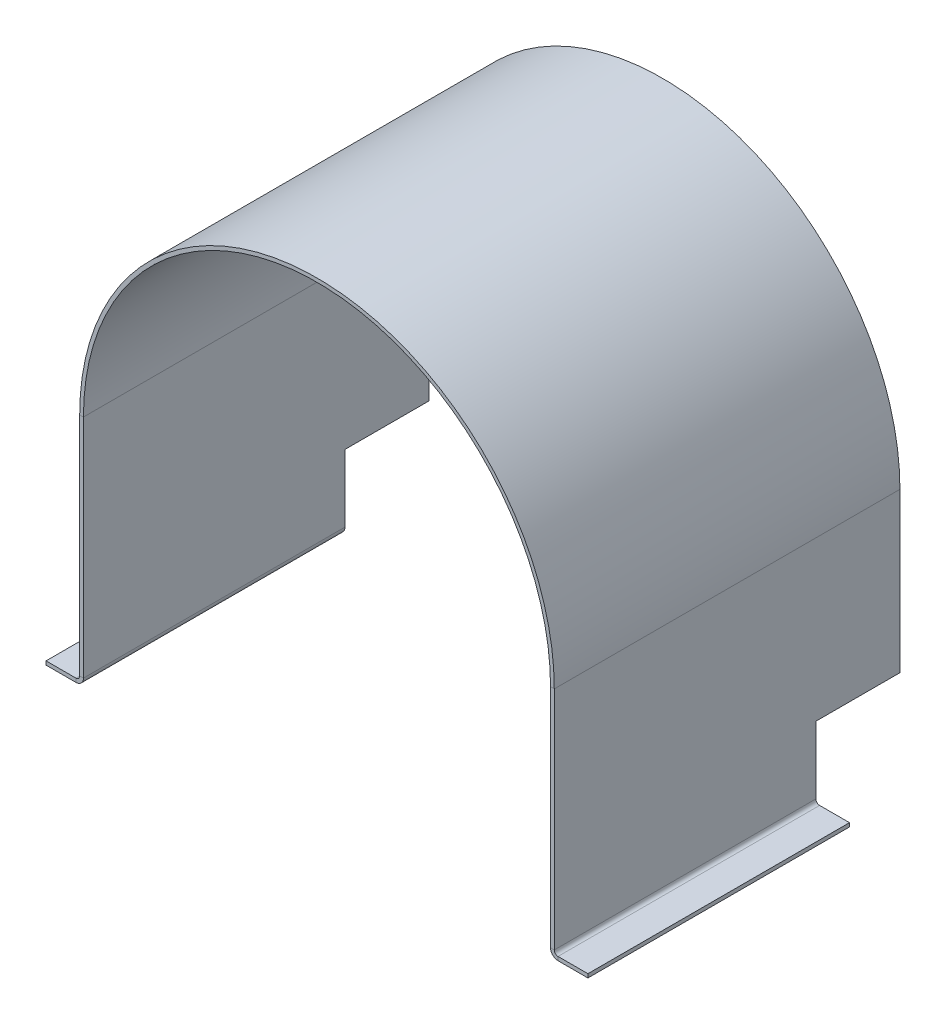
from build123d import *

# Parameters (mm, degrees)
BASE_FLANGE1_DEPTH  = 185
EXTRUDE1_DEPTH      = 353.615938381
EXTRUDE1_DEPTH_BACK = 353.615938381
SKETCH10_W          = 45
SKETCH10_H          = 40


# Sheet-metal steps are written as plain solids
with BuildPart() as part:
    # Sketch1 → Base-Flange1 (new body)
    with BuildSketch(Plane.XY):
        with BuildLine():
            Line((145, -125), (129, -125))
            ThreePointArc((129, -125), (126.171572875, -123.828427125), (125, -121))
            Line((125, -121), (125, 0))
            ThreePointArc((125, 0), (0, 125), (-125, 0))
            Line((-125, 0), (-125, -121))
            ThreePointArc((-125, -121), (-126.171572875, -123.828427125), (-129, -125))
            Line((-129, -125), (-145, -125))
            Line((-145, -125), (-145, -123))
            Line((-145, -123), (-129, -123))
            ThreePointArc((-129, -123), (-127.585786438, -122.414213562), (-127, -121))
            Line((-127, -121), (-127, 0))
            ThreePointArc((-127, 0), (0, 127), (127, 0))
            Line((127, 0), (127, -121))
            ThreePointArc((127, -121), (127.585786438, -122.414213562), (129, -123))
            Line((129, -123), (145, -123))
            Line((145, -123), (145, -125))
        make_face()
    extrude(amount=BASE_FLANGE1_DEPTH)

    # Sketch10 → Extrude1 (cut, two sides: drawn at the far end of the back side and taken through both)
    with BuildSketch(Plane(origin=(127, 0, 0), x_dir=(0, 0, -1), z_dir=(1, 0, 0)).offset(-EXTRUDE1_DEPTH_BACK)):
        with Locations((-22.5, -105)):
            Rectangle(SKETCH10_W, SKETCH10_H)
    extrude(amount=EXTRUDE1_DEPTH + EXTRUDE1_DEPTH_BACK, mode=Mode.SUBTRACT)


solid = part.part
